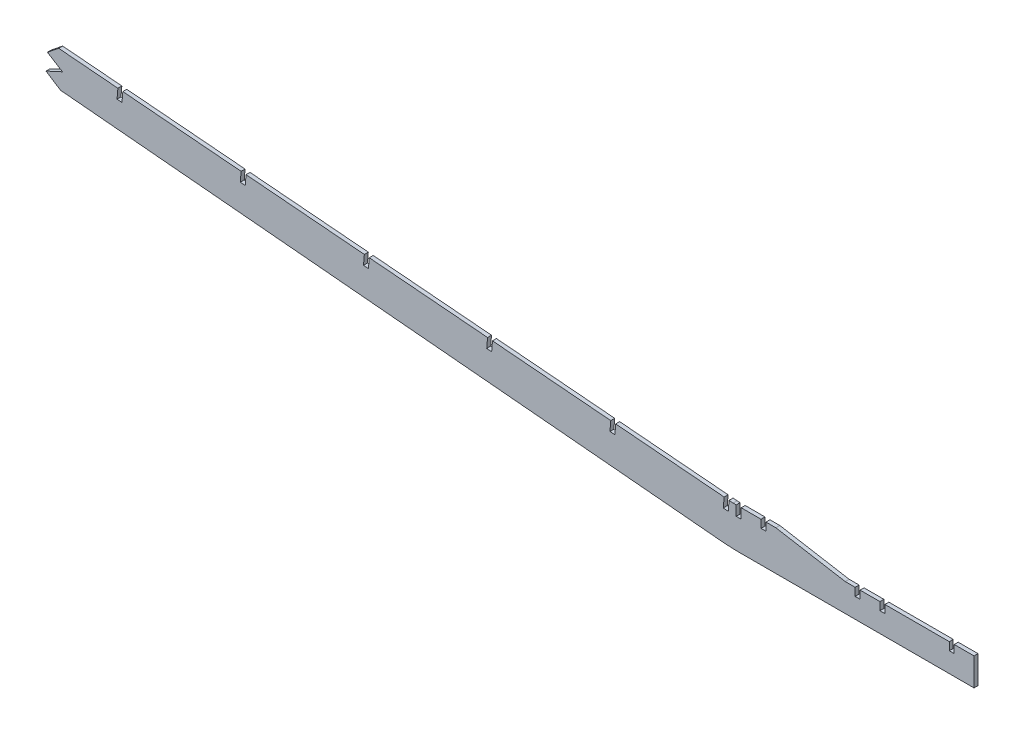
from build123d import *

# Parameters (mm, degrees)
BOSS_EXTRUDE1_DEPTH     = 2.54
CUT_EXTRUDE1_DEPTH      = 955.775766948
CUT_EXTRUDE1_DEPTH_BACK = 955.775766948
CUT_EXTRUDE2_DEPTH      = 7.62


with BuildPart() as part:
    # Sketch1 → Boss-Extrude1 (new body)
    with BuildSketch(Plane.XY):
        Polygon((-945.957227657, 86.137779906), (-945.969713578, 86.1172966), (-949.121092485, 86.403457059), (-949.65244679, 80.075727402), (-9.887238192, -5.25964904), (-6.723373364, -5.525326193), (0, -5.833733414), (152.4, -5.833733414), (152.4, 11.946266586), (139.7, 11.946266586), (139.7, 6.866266586), (136.525, 6.866266586), (136.525, 11.946266586), (95.25, 11.946266586), (95.25, 6.866266586), (92.075, 6.866266586), (92.075, 11.946266586), (79.375, 11.946266586), (79.375, 6.866266586), (76.2, 6.866266586), (76.2, 11.946266586), (69.85, 11.946266586), (25.4, 19.566266586), (19.05, 19.566266586), (19.05, 14.486266586), (15.875, 14.486266586), (15.875, 19.566266586), (3.175, 19.566266586), (3.175, 13.216266586), (0, 13.216266586), (0, 19.566266586), (-1.98607431, 19.566266586), (-4.597956143, 19.785592432), (-5.129310448, 13.457862776), (-8.293175277, 13.723539928), (-7.761820971, 20.051269584), (-944.89858306, 98.744842179), align=None)
    extrude(amount=BOSS_EXTRUDE1_DEPTH)

    # Sketch2 → Cut-Extrude1 (cut, two sides: drawn at the far end of the back side and taken through both)
    with BuildSketch(Plane.XY.offset(2.54).offset(-CUT_EXTRUDE1_DEPTH_BACK)):
        Polygon((-77.240292597, 25.885539855), (-80.404157425, 26.151217008), (-80.935453586, 19.824179771), (-77.77159129, 19.55847246), align=None)
        Polygon((-156.741594191, 26.190526923), (-156.210358707, 32.516841584), (-159.374223535, 32.782518736), (-159.905456487, 26.456234233), align=None)
        Polygon((-235.711597092, 32.822581386), (-235.180424816, 39.148143312), (-238.344289645, 39.413820465), (-238.875459388, 33.088288696), align=None)
        Polygon((-314.681599993, 39.454635849), (-314.150490926, 45.77944504), (-317.314355754, 46.045122193), (-317.845462289, 39.720343159), align=None)
        Polygon((-393.651602894, 46.086690311), (-393.120557036, 52.410746769), (-396.284421864, 52.676423921), (-396.81546519, 46.352397622), align=None)
        Polygon((-472.621605795, 52.718744774), (-472.090623146, 59.042048497), (-475.254487974, 59.30772565), (-475.785468091, 52.984452084), align=None)
        Polygon((-551.591608696, 59.350799237), (-551.060689256, 65.673350226), (-554.224554084, 65.939027378), (-554.755470992, 59.616506547), align=None)
        Polygon((-630.561611597, 65.9828537), (-630.030755365, 72.304651954), (-633.194620194, 72.570329107), (-633.725473893, 66.24856101), align=None)
        Polygon((-709.531614498, 72.614908162), (-709.000821475, 78.935953682), (-712.164686303, 79.201630835), (-712.695476794, 72.880615473), align=None)
        Polygon((-788.501617399, 79.246962625), (-787.970887585, 85.567255411), (-791.134752413, 85.832932563), (-791.665479694, 79.512669935), align=None)
        Polygon((-867.4716203, 85.879017088), (-866.940953695, 92.198557139), (-870.104818523, 92.464234292), (-870.635482595, 86.144724398), align=None)
    extrude(amount=CUT_EXTRUDE1_DEPTH + CUT_EXTRUDE1_DEPTH_BACK, mode=Mode.SUBTRACT)

    # Sketch3 → Cut-Extrude2 (cut)
    with BuildSketch(Plane.XY.offset(2.54)):
        Polygon((-434.187522505, 55.859236209), (-441.444486836, 50.074133547), (-431.803024179, 44.022577198), (-442.349656028, 39.171455119), (-433.014300591, 33.162402364), (-1000.074058288, -11.780320021), (-979.22273749, 133.880780984), align=None)
    extrude(amount=-CUT_EXTRUDE2_DEPTH, mode=Mode.SUBTRACT)


solid = part.part
